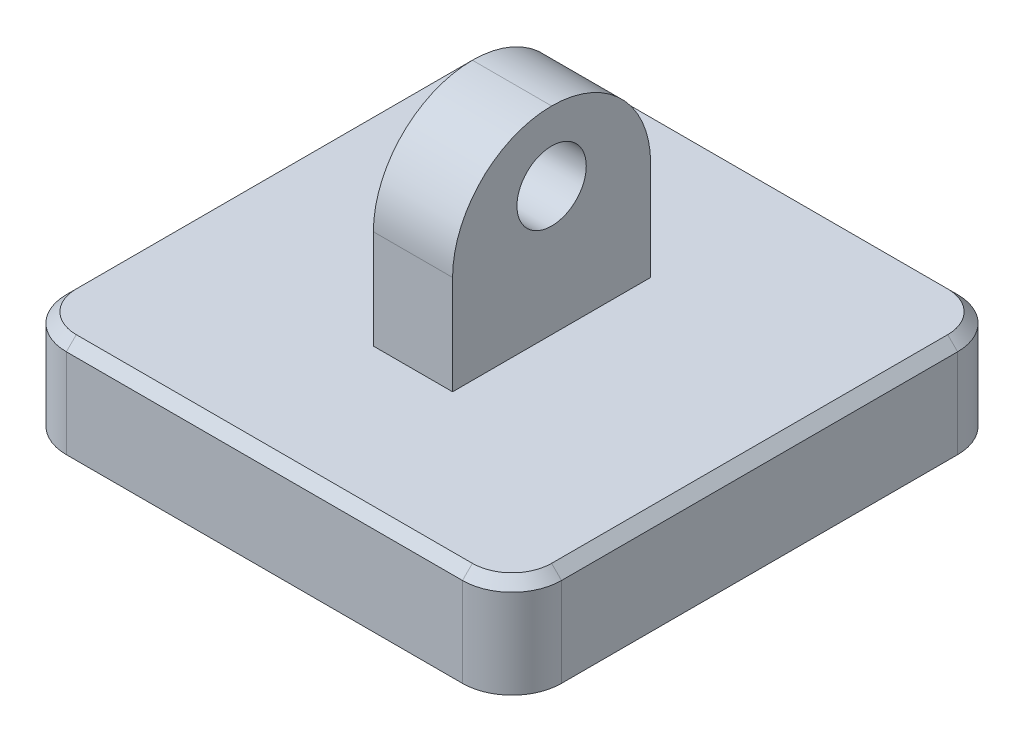
from build123d import *

# Parameters (mm, degrees)
CROQUIS1_W              = 50
CROQUIS1_H              = 50
SALIENTE_EXTRUIR1_DEPTH = 10
CROQUIS2_W              = 8
CROQUIS2_H              = 20
SALIENTE_EXTRUIR2_DEPTH = 20
CROQUIS3_R              = 3.5
CORTAR_EXTRUIR1_DEPTH   = 49.641546028
REDONDEO1_R             = 10
REDONDEO2_R             = 5
CHAFL_N1_SIZE           = 1


with BuildPart() as part:
    # Croquis1 → Saliente-Extruir1 (new body)
    with BuildSketch(Plane(origin=(0, 0, 0), x_dir=(1, 0, 0), z_dir=(0, 1, 0))):
        Rectangle(CROQUIS1_W, CROQUIS1_H)
    extrude(amount=SALIENTE_EXTRUIR1_DEPTH)

    # Croquis2 → Saliente-Extruir2 (add)
    with BuildSketch(Plane(origin=(0, 10, 0), x_dir=(1, 0, 0), z_dir=(0, 1, 0))):
        Rectangle(CROQUIS2_W, CROQUIS2_H)
    extrude(amount=SALIENTE_EXTRUIR2_DEPTH)

    # Croquis3 → Cortar-Extruir1 (cut, through all)
    with BuildSketch(Plane(origin=(4, 0, 0), x_dir=(0, 0, -1), z_dir=(1, 0, 0))):
        with Locations((0, 23)):
            Circle(CROQUIS3_R)
    extrude(amount=-CORTAR_EXTRUIR1_DEPTH, mode=Mode.SUBTRACT)

    # Redondeo1
    redondeo1_edges = [part.edges().sort_by_distance(p)[0] for p in [
        (0, 30, -10),
        (0, 30, 10),
    ]]
    fillet(redondeo1_edges, radius=REDONDEO1_R - 0.0001)  # a hair under: the kernel refuses the full size

    # Redondeo2
    redondeo2_edges = [part.edges().sort_by_distance(p)[0] for p in [
        (25, 5, 25),
        (-25, 5, 25),
        (-25, 5, -25),
        (25, 5, -25),
    ]]
    fillet(redondeo2_edges, radius=REDONDEO2_R)

    # Chaflán1
    chafl_n1_edges = [part.edges().sort_by_distance(p)[0] for p in [
        (-25, 10, 0),
        (0, 10, -25),
        (25, 10, 0),
        (0, 10, 25),
        (-23.535533906, 10, 23.535533906),
        (23.535533906, 10, 23.535533906),
        (23.535533906, 10, -23.535533906),
        (-23.535533906, 10, -23.535533906),
    ]]
    chamfer(chafl_n1_edges, length=CHAFL_N1_SIZE)


solid = part.part
